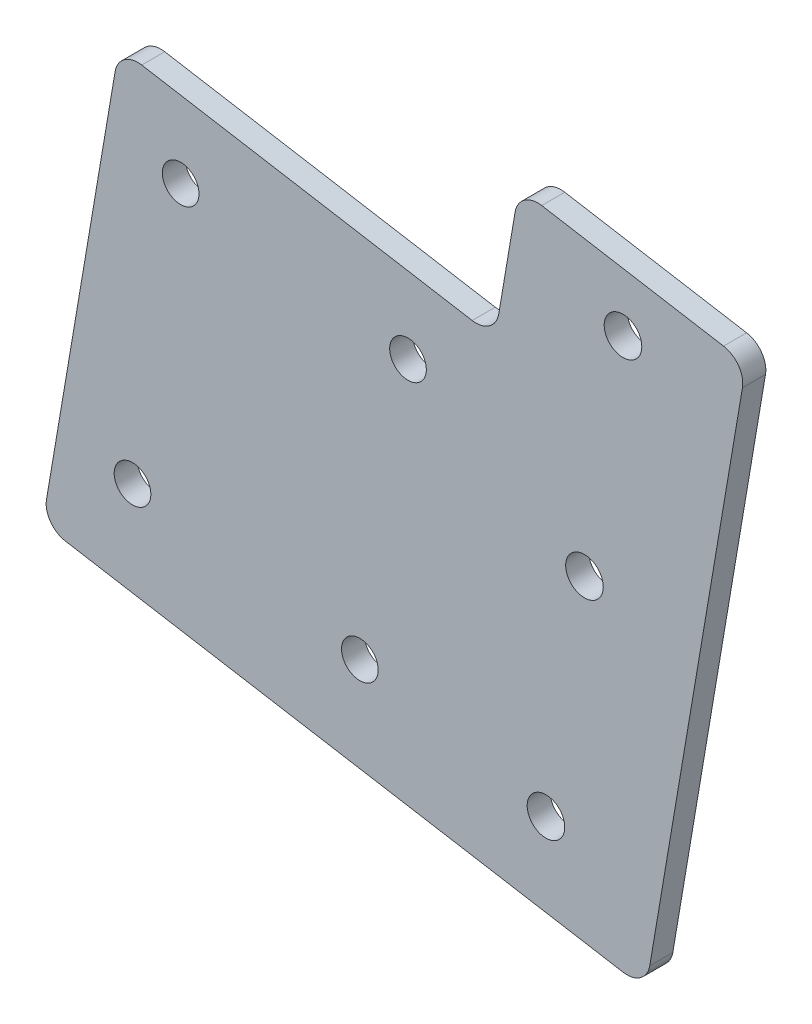
from build123d import *

# Parameters (mm, degrees)
SKETCH1_R           = 2.019299997
SKETCH1_R_2         = 2.019299996
SKETCH1_R_3         = 2.070099997
BOSS_EXTRUDE1_DEPTH = 2.54
FILLET2_R           = 2.54


with BuildPart() as part:
    # Sketch1 → Boss-Extrude1 (new body)
    with BuildSketch(Plane.XY):
        Polygon((-12.959899663, -36.98438298), (28.449865782, -44.000886797), (31.100646676, -28.356597569), (56.143695302, -32.599911782), (45.085639298, -97.861973534), (-21.367174772, -86.602155504), align=None)
        with Locations((-6.163136056, -46.554336191)):
            Circle(SKETCH1_R, mode=Mode.SUBTRACT)
        with Locations((-11.467278822, -77.858146974)):
            Circle(SKETCH1_R_2, mode=Mode.SUBTRACT)
        with Locations((18.87991257, -50.797650404)):
            Circle(SKETCH1_R_2, mode=Mode.SUBTRACT)
        with Locations((13.575769804, -82.101461187)):
            Circle(SKETCH1_R_2, mode=Mode.SUBTRACT)
        with Locations((38.318029948, -61.782055276)):
            Circle(SKETCH1_R_3, mode=Mode.SUBTRACT)
        with Locations((34.074715735, -86.825103902)):
            Circle(SKETCH1_R_3, mode=Mode.SUBTRACT)
        with Locations((42.561344161, -36.73900665)):
            Circle(SKETCH1_R_3, mode=Mode.SUBTRACT)
    extrude(amount=BOSS_EXTRUDE1_DEPTH)

    # Fillet2
    fillet2_edges = [part.edges().sort_by_distance(p)[0] for p in [
        (28.449865782, -44.000886797, 1.27),
        (31.100646676, -28.356597569, 1.27),
        (56.143695302, -32.599911782, 1.27),
        (45.085639298, -97.861973534, 1.27),
        (-21.367174772, -86.602155504, 1.27),
        (-12.959899663, -36.98438298, 1.27),
    ]]
    fillet(fillet2_edges, radius=FILLET2_R)


solid = part.part
